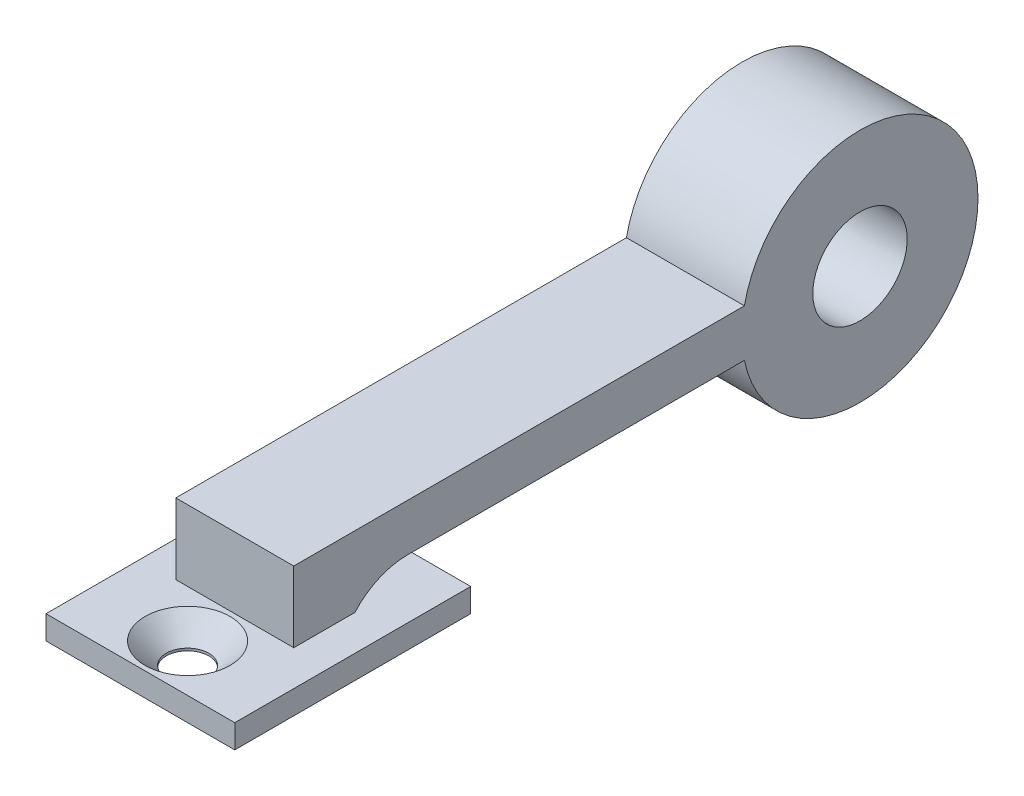
from build123d import *

# Parameters (mm, degrees)
SKETCH1_R                                            = 2
BOSS_EXTRUDE1_DEPTH                                  = 5
FILLET1_R                                            = 3
SKETCH2_W                                            = 8
SKETCH2_H                                            = 10
BOSS_EXTRUDE3_DEPTH                                  = 1
CSK_FOR_M1_6_COUNTERSUNK_FLAT_HEAD_SCREW_D           = 1.8
CSK_FOR_M1_6_COUNTERSUNK_FLAT_HEAD_SCREW_DEPTH       = 30
CSK_FOR_M1_6_COUNTERSUNK_FLAT_HEAD_SCREW_CSINK_D     = 3.6
CSK_FOR_M1_6_COUNTERSUNK_FLAT_HEAD_SCREW_CSINK_ANGLE = 90
CSK_FOR_M1_6_COUNTERSUNK_FLAT_HEAD_SCREW_TIP         = 0.540774557


with BuildPart() as part:
    # Sketch1 → Boss-Extrude1 (new body)
    with BuildSketch(Plane(origin=(0, 0, 0), x_dir=(0, 0, -1), z_dir=(1, 0, 0))):
        with BuildLine():
            Line((1, 2), (18.101020514, 2))
            ThreePointArc((18.101020514, 2), (28, 3), (18.101020514, 4))
            Line((18.101020514, 4), (-1, 4))
            Line((-1, 4), (-1, 0))
            Line((-1, 0), (1, 0))
            Line((1, 0), (1, 2))
        make_face()
        with Locations((23, 3)):
            Circle(SKETCH1_R, mode=Mode.SUBTRACT)
    extrude(amount=BOSS_EXTRUDE1_DEPTH)

    # Fillet1
    # the kernel refuses this fillet: 3 mm, written as the material it adds along each edge
    with BuildSketch(Plane(origin=(0, 2, -1), x_dir=(0, 0, -1), z_dir=(1, 0, 0))) as fillet1_piece_1:
        with BuildLine():
            CenterArc((2.828427125, -3), FILLET1_R, 90, 70.528779366)
            Line((0, -2), (-0.056568542, -1.98))
            ThreePointArc((-0.056568542, -1.98), (-0.06, -1), (-0.06, 0))
            Line((-0.06, 0), (0, 0.06))
            Line((0, 0.06), (2.828427125, 0.06))
            Line((2.828427125, 0.06), (2.828427125, 0))
        make_face()
    extrude(amount=5)

    # Sketch2 → Boss-Extrude3 (add)
    with BuildSketch(Plane.XZ):
        with Locations((2.5, 0)):
            Rectangle(SKETCH2_W, SKETCH2_H)
    extrude(amount=-BOSS_EXTRUDE3_DEPTH)

    # CSK for M1.6 Countersunk Flat Head Screw1
    with Locations(Plane(origin=(0, 1, 0), x_dir=(1, 0, 0), z_dir=(0, 1, 0))):
        with Locations((2.5, -3)):
            CounterSinkHole(CSK_FOR_M1_6_COUNTERSUNK_FLAT_HEAD_SCREW_D / 2, CSK_FOR_M1_6_COUNTERSUNK_FLAT_HEAD_SCREW_CSINK_D / 2, depth=CSK_FOR_M1_6_COUNTERSUNK_FLAT_HEAD_SCREW_DEPTH, counter_sink_angle=CSK_FOR_M1_6_COUNTERSUNK_FLAT_HEAD_SCREW_CSINK_ANGLE)
            with Locations((0, 0, -(CSK_FOR_M1_6_COUNTERSUNK_FLAT_HEAD_SCREW_DEPTH + CSK_FOR_M1_6_COUNTERSUNK_FLAT_HEAD_SCREW_TIP / 2))):  # 118° drill point
                Cone(0, CSK_FOR_M1_6_COUNTERSUNK_FLAT_HEAD_SCREW_D / 2, CSK_FOR_M1_6_COUNTERSUNK_FLAT_HEAD_SCREW_TIP, mode=Mode.SUBTRACT)


solid = part.part
